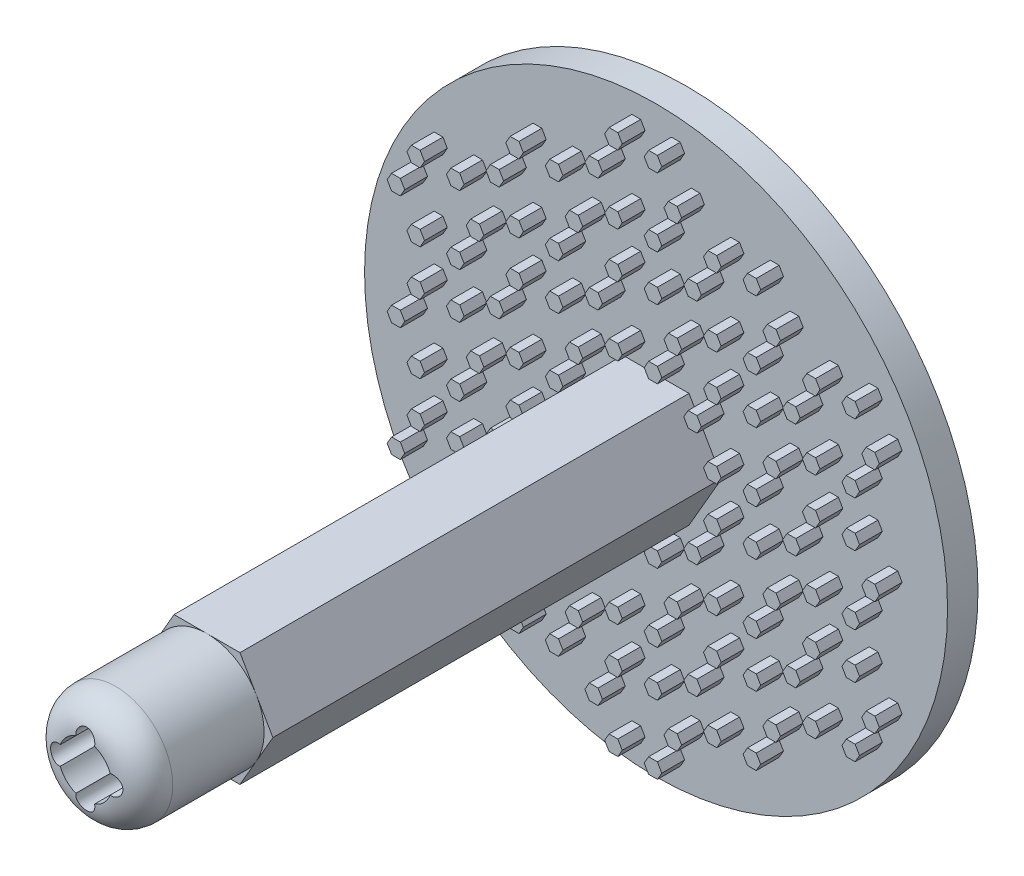
from build123d import *

# Parameters (mm, degrees)
SKETCH1_R                 = 48.641
BOSS_EXTRUDE1_DEPTH       = 5.08
SKETCH2_R                 = 9.525
BOSS_EXTRUDE2_DEPTH       = 95.25
SKETCH3_R                 = 6.604
CUT_EXTRUDE1_DEPTH        = 74.93
BOSS_EXTRUDE3_DEPTH       = 74.93
ORIGINAL_FEMALE_NUB_DEPTH = 3.81
CIRPATTERN1_COUNT         = 6
CIRPATTERN2_COPY_1_DEPTH  = 3.81
CIRPATTERN2_COPY_2_DEPTH  = 3.81
CIRPATTERN2_COPY_3_DEPTH  = 3.81
CIRPATTERN2_COPY_4_DEPTH  = 3.81
CIRPATTERN2_COPY_5_DEPTH  = 3.81
CIRPATTERN2_COPY_6_DEPTH  = 3.81
CIRPATTERN2_COPY_7_DEPTH  = 3.81
CIRPATTERN2_COPY_8_DEPTH  = 3.81
CIRPATTERN2_COPY_9_DEPTH  = 3.81
CIRPATTERN2_COPY_10_DEPTH = 3.81
CIRPATTERN3_COPY_1_DEPTH  = 3.81
CIRPATTERN3_COPY_2_DEPTH  = 3.81
CIRPATTERN3_COPY_3_DEPTH  = 3.81
CIRPATTERN3_COPY_4_DEPTH  = 3.81
CIRPATTERN3_COPY_5_DEPTH  = 3.81
CIRPATTERN3_COPY_6_DEPTH  = 3.81
CIRPATTERN3_COPY_7_DEPTH  = 3.81
CIRPATTERN3_COPY_8_DEPTH  = 3.81
CIRPATTERN3_COPY_9_DEPTH  = 3.81
CIRPATTERN3_COPY_10_DEPTH = 3.81
FILLET1_R                 = 5.08
CUT_EXTRUDE2_DEPTH        = 12.7


with BuildPart() as part:
    # Sketch1 → Boss-Extrude1 (new body)
    with BuildSketch(Plane.XY):
        Circle(SKETCH1_R)
    extrude(amount=BOSS_EXTRUDE1_DEPTH)

    # Sketch2 → Boss-Extrude2 (add)
    with BuildSketch(Plane.XY.offset(5.08)):
        Circle(SKETCH2_R)
    extrude(amount=BOSS_EXTRUDE2_DEPTH)

    # Sketch3 → Cut-Extrude1 (cut)
    with BuildSketch(Plane(origin=(0, 0, 0), x_dir=(-1, 0, 0), z_dir=(0, 0, -1))):
        Circle(SKETCH3_R)
    extrude(amount=-CUT_EXTRUDE1_DEPTH, mode=Mode.SUBTRACT)

    # Sketch4 → Boss-Extrude3 (add)
    with BuildSketch(Plane.XY.offset(5.08)):
        with BuildLine():
            Line((8.248891914, -4.762500099), (10.998522628, 0))
            Line((10.998522628, 0), (8.248892012, 4.762499929))
            ThreePointArc((8.248892012, 4.762499929), (9.525, -9.8e-08), (8.248891914, -4.762500099))
        make_face()
        with BuildLine():
            ThreePointArc((0, 9.525), (4.762500036, 8.248891951), (8.248892012, 4.762499929))
            Line((8.248892012, 4.762499929), (5.499261314, 9.525))
            Line((5.499261314, 9.525), (0, 9.525))
        make_face()
        with BuildLine():
            Line((5.499261314, -9.525), (8.248891914, -4.762500099))
            ThreePointArc((8.248891914, -4.762500099), (4.76249998, -8.248891983), (6.8e-08, -9.525))
            Line((6.8e-08, -9.525), (5.499261314, -9.525))
        make_face()
        with BuildLine():
            ThreePointArc((-8.248891793, 4.762500308), (-4.762499846, 8.24889206), (0, 9.525))
            Line((0, 9.525), (-5.499261314, 9.525))
            Line((-5.499261314, 9.525), (-8.248891793, 4.762500308))
        make_face()
        with BuildLine():
            Line((-5.499261314, -9.525), (6.8e-08, -9.525))
            ThreePointArc((6.8e-08, -9.525), (-4.762499966, -8.248891991), (-8.248891966, -4.762500008))
            Line((-8.248891966, -4.762500008), (-5.499261314, -9.525))
        make_face()
        with BuildLine():
            ThreePointArc((-8.248891966, -4.762500008), (-9.525, 1.73e-07), (-8.248891793, 4.762500308))
            Line((-8.248891793, 4.762500308), (-10.998522628, 0))
            Line((-10.998522628, 0), (-8.248891966, -4.762500008))
        make_face()
    extrude(amount=BOSS_EXTRUDE3_DEPTH)

    # Sketch5 → original_female_nub (add)
    with BuildSketch(Plane.XY.offset(5.08)):
        Polygon((4.03279163, -26.035), (4.766026472, -24.765), (4.03279163, -23.495), (2.566321947, -23.495), (1.833087105, -24.765), (2.566321947, -26.035), align=None)
        Polygon((2.566321947, -12.065), (1.833087105, -13.335), (2.566321947, -14.605), (4.03279163, -14.605), (4.766026472, -13.335), (4.03279163, -12.065), align=None)
        Polygon((-1.833087105, -24.765), (-2.566321947, -23.495), (-4.03279163, -23.495), (-4.766026472, -24.765), (-4.03279163, -26.035), (-2.566321947, -26.035), align=None)
        Polygon((-4.03279163, -14.605), (-2.566321947, -14.605), (-1.833087105, -13.335), (-2.566321947, -12.065), (-4.03279163, -12.065), (-4.766026472, -13.335), align=None)
        Polygon((7.332348419, -17.78), (5.865878735, -17.78), (5.132643893, -19.05), (5.865878735, -20.32), (7.332348419, -20.32), (8.065583261, -19.05), align=None)
        Polygon((-5.865878735, -17.78), (-7.332348419, -17.78), (-8.065583261, -19.05), (-7.332348419, -20.32), (-5.865878735, -20.32), (-5.132643893, -19.05), align=None)
    original_female_nub = extrude(amount=ORIGINAL_FEMALE_NUB_DEPTH)

    # CirPattern1: original_female_nub ×6 about axis
    cirpattern1_axis = Axis((0, 0, 100.33), (0, 0, 1))
    for i in range(1, CIRPATTERN1_COUNT):
        add(original_female_nub.rotate(cirpattern1_axis, i * 360 / CIRPATTERN1_COUNT))

    # Mirror1: original_female_nub across plane
    add(original_female_nub.mirror(Plane(origin=(0, -28.575, 0), x_dir=(0, 0, 1), z_dir=(0, -1, 0))))

    # CirPattern2 copy 1 sketch → CirPattern2 copy 1 (add)
    with BuildSketch(Plane(origin=(49.493351826, -28.575, 5.08), x_dir=(0.5000000000000001, 0.8660254037844386, 0), z_dir=(0, 0, 1))):
        Polygon((4.03279163, 26.035), (4.766026472, 24.765), (4.03279163, 23.495), (2.566321947, 23.495), (1.833087105, 24.765), (2.566321947, 26.035), align=None)
        Polygon((2.566321947, 12.065), (1.833087105, 13.335), (2.566321947, 14.605), (4.03279163, 14.605), (4.766026472, 13.335), (4.03279163, 12.065), align=None)
        Polygon((-1.833087105, 24.765), (-2.566321947, 23.495), (-4.03279163, 23.495), (-4.766026472, 24.765), (-4.03279163, 26.035), (-2.566321947, 26.035), align=None)
        Polygon((-4.03279163, 14.605), (-2.566321947, 14.605), (-1.833087105, 13.335), (-2.566321947, 12.065), (-4.03279163, 12.065), (-4.766026472, 13.335), align=None)
        Polygon((7.332348419, 17.78), (5.865878735, 17.78), (5.132643893, 19.05), (5.865878735, 20.32), (7.332348419, 20.32), (8.065583261, 19.05), align=None)
        Polygon((-5.865878735, 17.78), (-7.332348419, 17.78), (-8.065583261, 19.05), (-7.332348419, 20.32), (-5.865878735, 20.32), (-5.132643893, 19.05), align=None)
    extrude(amount=CIRPATTERN2_COPY_1_DEPTH)

    # CirPattern2 copy 2 sketch → CirPattern2 copy 2 (add)
    with BuildSketch(Plane(origin=(49.493351826, 28.575, 5.08), x_dir=(-0.4999999999999998, 0.8660254037844387, 0), z_dir=(0, 0, 1))):
        Polygon((4.03279163, 26.035), (4.766026472, 24.765), (4.03279163, 23.495), (2.566321947, 23.495), (1.833087105, 24.765), (2.566321947, 26.035), align=None)
        Polygon((2.566321947, 12.065), (1.833087105, 13.335), (2.566321947, 14.605), (4.03279163, 14.605), (4.766026472, 13.335), (4.03279163, 12.065), align=None)
        Polygon((-1.833087105, 24.765), (-2.566321947, 23.495), (-4.03279163, 23.495), (-4.766026472, 24.765), (-4.03279163, 26.035), (-2.566321947, 26.035), align=None)
        Polygon((-4.03279163, 14.605), (-2.566321947, 14.605), (-1.833087105, 13.335), (-2.566321947, 12.065), (-4.03279163, 12.065), (-4.766026472, 13.335), align=None)
        Polygon((7.332348419, 17.78), (5.865878735, 17.78), (5.132643893, 19.05), (5.865878735, 20.32), (7.332348419, 20.32), (8.065583261, 19.05), align=None)
        Polygon((-5.865878735, 17.78), (-7.332348419, 17.78), (-8.065583261, 19.05), (-7.332348419, 20.32), (-5.865878735, 20.32), (-5.132643893, 19.05), align=None)
    extrude(amount=CIRPATTERN2_COPY_2_DEPTH)

    # CirPattern2 copy 3 sketch → CirPattern2 copy 3 (add)
    with BuildSketch(Plane(origin=(0, 57.15, 5.08), x_dir=(-1, 0, 0), z_dir=(0, 0, 1))):
        Polygon((4.03279163, 26.035), (4.766026472, 24.765), (4.03279163, 23.495), (2.566321947, 23.495), (1.833087105, 24.765), (2.566321947, 26.035), align=None)
        Polygon((2.566321947, 12.065), (1.833087105, 13.335), (2.566321947, 14.605), (4.03279163, 14.605), (4.766026472, 13.335), (4.03279163, 12.065), align=None)
        Polygon((-1.833087105, 24.765), (-2.566321947, 23.495), (-4.03279163, 23.495), (-4.766026472, 24.765), (-4.03279163, 26.035), (-2.566321947, 26.035), align=None)
        Polygon((-4.03279163, 14.605), (-2.566321947, 14.605), (-1.833087105, 13.335), (-2.566321947, 12.065), (-4.03279163, 12.065), (-4.766026472, 13.335), align=None)
        Polygon((7.332348419, 17.78), (5.865878735, 17.78), (5.132643893, 19.05), (5.865878735, 20.32), (7.332348419, 20.32), (8.065583261, 19.05), align=None)
        Polygon((-5.865878735, 17.78), (-7.332348419, 17.78), (-8.065583261, 19.05), (-7.332348419, 20.32), (-5.865878735, 20.32), (-5.132643893, 19.05), align=None)
    extrude(amount=CIRPATTERN2_COPY_3_DEPTH)

    # CirPattern2 copy 4 sketch → CirPattern2 copy 4 (add)
    with BuildSketch(Plane(origin=(-49.493351826, 28.575, 5.08), x_dir=(-0.5000000000000004, -0.8660254037844384, 0), z_dir=(0, 0, 1))):
        Polygon((4.03279163, 26.035), (4.766026472, 24.765), (4.03279163, 23.495), (2.566321947, 23.495), (1.833087105, 24.765), (2.566321947, 26.035), align=None)
        Polygon((2.566321947, 12.065), (1.833087105, 13.335), (2.566321947, 14.605), (4.03279163, 14.605), (4.766026472, 13.335), (4.03279163, 12.065), align=None)
        Polygon((-1.833087105, 24.765), (-2.566321947, 23.495), (-4.03279163, 23.495), (-4.766026472, 24.765), (-4.03279163, 26.035), (-2.566321947, 26.035), align=None)
        Polygon((-4.03279163, 14.605), (-2.566321947, 14.605), (-1.833087105, 13.335), (-2.566321947, 12.065), (-4.03279163, 12.065), (-4.766026472, 13.335), align=None)
        Polygon((7.332348419, 17.78), (5.865878735, 17.78), (5.132643893, 19.05), (5.865878735, 20.32), (7.332348419, 20.32), (8.065583261, 19.05), align=None)
        Polygon((-5.865878735, 17.78), (-7.332348419, 17.78), (-8.065583261, 19.05), (-7.332348419, 20.32), (-5.865878735, 20.32), (-5.132643893, 19.05), align=None)
    extrude(amount=CIRPATTERN2_COPY_4_DEPTH)

    # CirPattern2 copy 5 sketch → CirPattern2 copy 5 (add)
    with BuildSketch(Plane(origin=(-49.493351826, -28.575, 5.08), x_dir=(0.5000000000000001, -0.8660254037844386, 0), z_dir=(0, 0, 1))):
        Polygon((4.03279163, 26.035), (4.766026472, 24.765), (4.03279163, 23.495), (2.566321947, 23.495), (1.833087105, 24.765), (2.566321947, 26.035), align=None)
        Polygon((2.566321947, 12.065), (1.833087105, 13.335), (2.566321947, 14.605), (4.03279163, 14.605), (4.766026472, 13.335), (4.03279163, 12.065), align=None)
        Polygon((-1.833087105, 24.765), (-2.566321947, 23.495), (-4.03279163, 23.495), (-4.766026472, 24.765), (-4.03279163, 26.035), (-2.566321947, 26.035), align=None)
        Polygon((-4.03279163, 14.605), (-2.566321947, 14.605), (-1.833087105, 13.335), (-2.566321947, 12.065), (-4.03279163, 12.065), (-4.766026472, 13.335), align=None)
        Polygon((7.332348419, 17.78), (5.865878735, 17.78), (5.132643893, 19.05), (5.865878735, 20.32), (7.332348419, 20.32), (8.065583261, 19.05), align=None)
        Polygon((-5.865878735, 17.78), (-7.332348419, 17.78), (-8.065583261, 19.05), (-7.332348419, 20.32), (-5.865878735, 20.32), (-5.132643893, 19.05), align=None)
    extrude(amount=CIRPATTERN2_COPY_5_DEPTH)

    # CirPattern2 copy 6 sketch → CirPattern2 copy 6 (add)
    with BuildSketch(Plane(origin=(0, 0, 5.08), x_dir=(0.5000000000000001, 0.8660254037844386, 0), z_dir=(0, 0, 1))):
        Polygon((4.03279163, -26.035), (4.766026472, -24.765), (4.03279163, -23.495), (2.566321947, -23.495), (1.833087105, -24.765), (2.566321947, -26.035), align=None)
        Polygon((2.566321947, -12.065), (1.833087105, -13.335), (2.566321947, -14.605), (4.03279163, -14.605), (4.766026472, -13.335), (4.03279163, -12.065), align=None)
        Polygon((-1.833087105, -24.765), (-2.566321947, -23.495), (-4.03279163, -23.495), (-4.766026472, -24.765), (-4.03279163, -26.035), (-2.566321947, -26.035), align=None)
        Polygon((-4.03279163, -14.605), (-2.566321947, -14.605), (-1.833087105, -13.335), (-2.566321947, -12.065), (-4.03279163, -12.065), (-4.766026472, -13.335), align=None)
        Polygon((7.332348419, -17.78), (5.865878735, -17.78), (5.132643893, -19.05), (5.865878735, -20.32), (7.332348419, -20.32), (8.065583261, -19.05), align=None)
        Polygon((-5.865878735, -17.78), (-7.332348419, -17.78), (-8.065583261, -19.05), (-7.332348419, -20.32), (-5.865878735, -20.32), (-5.132643893, -19.05), align=None)
    extrude(amount=CIRPATTERN2_COPY_6_DEPTH)

    # CirPattern2 copy 7 sketch → CirPattern2 copy 7 (add)
    with BuildSketch(Plane(origin=(0, 0, 5.08), x_dir=(-0.4999999999999998, 0.8660254037844387, 0), z_dir=(0, 0, 1))):
        Polygon((4.03279163, -26.035), (4.766026472, -24.765), (4.03279163, -23.495), (2.566321947, -23.495), (1.833087105, -24.765), (2.566321947, -26.035), align=None)
        Polygon((2.566321947, -12.065), (1.833087105, -13.335), (2.566321947, -14.605), (4.03279163, -14.605), (4.766026472, -13.335), (4.03279163, -12.065), align=None)
        Polygon((-1.833087105, -24.765), (-2.566321947, -23.495), (-4.03279163, -23.495), (-4.766026472, -24.765), (-4.03279163, -26.035), (-2.566321947, -26.035), align=None)
        Polygon((-4.03279163, -14.605), (-2.566321947, -14.605), (-1.833087105, -13.335), (-2.566321947, -12.065), (-4.03279163, -12.065), (-4.766026472, -13.335), align=None)
        Polygon((7.332348419, -17.78), (5.865878735, -17.78), (5.132643893, -19.05), (5.865878735, -20.32), (7.332348419, -20.32), (8.065583261, -19.05), align=None)
        Polygon((-5.865878735, -17.78), (-7.332348419, -17.78), (-8.065583261, -19.05), (-7.332348419, -20.32), (-5.865878735, -20.32), (-5.132643893, -19.05), align=None)
    extrude(amount=CIRPATTERN2_COPY_7_DEPTH)

    # CirPattern2 copy 8 sketch → CirPattern2 copy 8 (add)
    with BuildSketch(Plane(origin=(0, 0, 5.08), x_dir=(-1, 0, 0), z_dir=(0, 0, 1))):
        Polygon((4.03279163, -26.035), (4.766026472, -24.765), (4.03279163, -23.495), (2.566321947, -23.495), (1.833087105, -24.765), (2.566321947, -26.035), align=None)
        Polygon((2.566321947, -12.065), (1.833087105, -13.335), (2.566321947, -14.605), (4.03279163, -14.605), (4.766026472, -13.335), (4.03279163, -12.065), align=None)
        Polygon((-1.833087105, -24.765), (-2.566321947, -23.495), (-4.03279163, -23.495), (-4.766026472, -24.765), (-4.03279163, -26.035), (-2.566321947, -26.035), align=None)
        Polygon((-4.03279163, -14.605), (-2.566321947, -14.605), (-1.833087105, -13.335), (-2.566321947, -12.065), (-4.03279163, -12.065), (-4.766026472, -13.335), align=None)
        Polygon((7.332348419, -17.78), (5.865878735, -17.78), (5.132643893, -19.05), (5.865878735, -20.32), (7.332348419, -20.32), (8.065583261, -19.05), align=None)
        Polygon((-5.865878735, -17.78), (-7.332348419, -17.78), (-8.065583261, -19.05), (-7.332348419, -20.32), (-5.865878735, -20.32), (-5.132643893, -19.05), align=None)
    extrude(amount=CIRPATTERN2_COPY_8_DEPTH)

    # CirPattern2 copy 9 sketch → CirPattern2 copy 9 (add)
    with BuildSketch(Plane(origin=(0, 0, 5.08), x_dir=(-0.5000000000000004, -0.8660254037844384, 0), z_dir=(0, 0, 1))):
        Polygon((4.03279163, -26.035), (4.766026472, -24.765), (4.03279163, -23.495), (2.566321947, -23.495), (1.833087105, -24.765), (2.566321947, -26.035), align=None)
        Polygon((2.566321947, -12.065), (1.833087105, -13.335), (2.566321947, -14.605), (4.03279163, -14.605), (4.766026472, -13.335), (4.03279163, -12.065), align=None)
        Polygon((-1.833087105, -24.765), (-2.566321947, -23.495), (-4.03279163, -23.495), (-4.766026472, -24.765), (-4.03279163, -26.035), (-2.566321947, -26.035), align=None)
        Polygon((-4.03279163, -14.605), (-2.566321947, -14.605), (-1.833087105, -13.335), (-2.566321947, -12.065), (-4.03279163, -12.065), (-4.766026472, -13.335), align=None)
        Polygon((7.332348419, -17.78), (5.865878735, -17.78), (5.132643893, -19.05), (5.865878735, -20.32), (7.332348419, -20.32), (8.065583261, -19.05), align=None)
        Polygon((-5.865878735, -17.78), (-7.332348419, -17.78), (-8.065583261, -19.05), (-7.332348419, -20.32), (-5.865878735, -20.32), (-5.132643893, -19.05), align=None)
    extrude(amount=CIRPATTERN2_COPY_9_DEPTH)

    # CirPattern2 copy 10 sketch → CirPattern2 copy 10 (add)
    with BuildSketch(Plane(origin=(0, 0, 5.08), x_dir=(0.5000000000000001, -0.8660254037844386, 0), z_dir=(0, 0, 1))):
        Polygon((4.03279163, -26.035), (4.766026472, -24.765), (4.03279163, -23.495), (2.566321947, -23.495), (1.833087105, -24.765), (2.566321947, -26.035), align=None)
        Polygon((2.566321947, -12.065), (1.833087105, -13.335), (2.566321947, -14.605), (4.03279163, -14.605), (4.766026472, -13.335), (4.03279163, -12.065), align=None)
        Polygon((-1.833087105, -24.765), (-2.566321947, -23.495), (-4.03279163, -23.495), (-4.766026472, -24.765), (-4.03279163, -26.035), (-2.566321947, -26.035), align=None)
        Polygon((-4.03279163, -14.605), (-2.566321947, -14.605), (-1.833087105, -13.335), (-2.566321947, -12.065), (-4.03279163, -12.065), (-4.766026472, -13.335), align=None)
        Polygon((7.332348419, -17.78), (5.865878735, -17.78), (5.132643893, -19.05), (5.865878735, -20.32), (7.332348419, -20.32), (8.065583261, -19.05), align=None)
        Polygon((-5.865878735, -17.78), (-7.332348419, -17.78), (-8.065583261, -19.05), (-7.332348419, -20.32), (-5.865878735, -20.32), (-5.132643893, -19.05), align=None)
    extrude(amount=CIRPATTERN2_COPY_10_DEPTH)

    # Mirror2: original_female_nub across plane
    add(original_female_nub.mirror(Plane(origin=(-16.497783942, -9.525, 0), x_dir=(0, 0, 1), z_dir=(0.8660254037844386, 0.5000000000000001, 0))))

    # CirPattern3 copy 1 sketch → CirPattern3 copy 1 (add)
    with BuildSketch(Plane(origin=(0, -38.1, 5.08), x_dir=(0.5000000000000002, -0.8660254037844386, 0), z_dir=(0, 0, 1))):
        Polygon((4.03279163, 26.035), (4.766026472, 24.765), (4.03279163, 23.495), (2.566321947, 23.495), (1.833087105, 24.765), (2.566321947, 26.035), align=None)
        Polygon((2.566321947, 12.065), (1.833087105, 13.335), (2.566321947, 14.605), (4.03279163, 14.605), (4.766026472, 13.335), (4.03279163, 12.065), align=None)
        Polygon((-1.833087105, 24.765), (-2.566321947, 23.495), (-4.03279163, 23.495), (-4.766026472, 24.765), (-4.03279163, 26.035), (-2.566321947, 26.035), align=None)
        Polygon((-4.03279163, 14.605), (-2.566321947, 14.605), (-1.833087105, 13.335), (-2.566321947, 12.065), (-4.03279163, 12.065), (-4.766026472, 13.335), align=None)
        Polygon((7.332348419, 17.78), (5.865878735, 17.78), (5.132643893, 19.05), (5.865878735, 20.32), (7.332348419, 20.32), (8.065583261, 19.05), align=None)
        Polygon((-5.865878735, 17.78), (-7.332348419, 17.78), (-8.065583261, 19.05), (-7.332348419, 20.32), (-5.865878735, 20.32), (-5.132643893, 19.05), align=None)
    extrude(amount=CIRPATTERN3_COPY_1_DEPTH)

    # CirPattern3 copy 2 sketch → CirPattern3 copy 2 (add)
    with BuildSketch(Plane(origin=(32.995567884, -19.05, 5.08), x_dir=(1, 0, 0), z_dir=(0, 0, 1))):
        Polygon((4.03279163, 26.035), (4.766026472, 24.765), (4.03279163, 23.495), (2.566321947, 23.495), (1.833087105, 24.765), (2.566321947, 26.035), align=None)
        Polygon((2.566321947, 12.065), (1.833087105, 13.335), (2.566321947, 14.605), (4.03279163, 14.605), (4.766026472, 13.335), (4.03279163, 12.065), align=None)
        Polygon((-1.833087105, 24.765), (-2.566321947, 23.495), (-4.03279163, 23.495), (-4.766026472, 24.765), (-4.03279163, 26.035), (-2.566321947, 26.035), align=None)
        Polygon((-4.03279163, 14.605), (-2.566321947, 14.605), (-1.833087105, 13.335), (-2.566321947, 12.065), (-4.03279163, 12.065), (-4.766026472, 13.335), align=None)
        Polygon((7.332348419, 17.78), (5.865878735, 17.78), (5.132643893, 19.05), (5.865878735, 20.32), (7.332348419, 20.32), (8.065583261, 19.05), align=None)
        Polygon((-5.865878735, 17.78), (-7.332348419, 17.78), (-8.065583261, 19.05), (-7.332348419, 20.32), (-5.865878735, 20.32), (-5.132643893, 19.05), align=None)
    extrude(amount=CIRPATTERN3_COPY_2_DEPTH)

    # CirPattern3 copy 3 sketch → CirPattern3 copy 3 (add)
    with BuildSketch(Plane(origin=(32.995567884, 19.05, 5.08), x_dir=(0.4999999999999999, 0.8660254037844387, 0), z_dir=(0, 0, 1))):
        Polygon((4.03279163, 26.035), (4.766026472, 24.765), (4.03279163, 23.495), (2.566321947, 23.495), (1.833087105, 24.765), (2.566321947, 26.035), align=None)
        Polygon((2.566321947, 12.065), (1.833087105, 13.335), (2.566321947, 14.605), (4.03279163, 14.605), (4.766026472, 13.335), (4.03279163, 12.065), align=None)
        Polygon((-1.833087105, 24.765), (-2.566321947, 23.495), (-4.03279163, 23.495), (-4.766026472, 24.765), (-4.03279163, 26.035), (-2.566321947, 26.035), align=None)
        Polygon((-4.03279163, 14.605), (-2.566321947, 14.605), (-1.833087105, 13.335), (-2.566321947, 12.065), (-4.03279163, 12.065), (-4.766026472, 13.335), align=None)
        Polygon((7.332348419, 17.78), (5.865878735, 17.78), (5.132643893, 19.05), (5.865878735, 20.32), (7.332348419, 20.32), (8.065583261, 19.05), align=None)
        Polygon((-5.865878735, 17.78), (-7.332348419, 17.78), (-8.065583261, 19.05), (-7.332348419, 20.32), (-5.865878735, 20.32), (-5.132643893, 19.05), align=None)
    extrude(amount=CIRPATTERN3_COPY_3_DEPTH)

    # CirPattern3 copy 4 sketch → CirPattern3 copy 4 (add)
    with BuildSketch(Plane(origin=(0, 38.1, 5.08), x_dir=(-0.4999999999999998, 0.8660254037844388, 0), z_dir=(0, 0, 1))):
        Polygon((4.03279163, 26.035), (4.766026472, 24.765), (4.03279163, 23.495), (2.566321947, 23.495), (1.833087105, 24.765), (2.566321947, 26.035), align=None)
        Polygon((2.566321947, 12.065), (1.833087105, 13.335), (2.566321947, 14.605), (4.03279163, 14.605), (4.766026472, 13.335), (4.03279163, 12.065), align=None)
        Polygon((-1.833087105, 24.765), (-2.566321947, 23.495), (-4.03279163, 23.495), (-4.766026472, 24.765), (-4.03279163, 26.035), (-2.566321947, 26.035), align=None)
        Polygon((-4.03279163, 14.605), (-2.566321947, 14.605), (-1.833087105, 13.335), (-2.566321947, 12.065), (-4.03279163, 12.065), (-4.766026472, 13.335), align=None)
        Polygon((7.332348419, 17.78), (5.865878735, 17.78), (5.132643893, 19.05), (5.865878735, 20.32), (7.332348419, 20.32), (8.065583261, 19.05), align=None)
        Polygon((-5.865878735, 17.78), (-7.332348419, 17.78), (-8.065583261, 19.05), (-7.332348419, 20.32), (-5.865878735, 20.32), (-5.132643893, 19.05), align=None)
    extrude(amount=CIRPATTERN3_COPY_4_DEPTH)

    # CirPattern3 copy 5 sketch → CirPattern3 copy 5 (add)
    with BuildSketch(Plane(origin=(-32.995567884, 19.05, 5.08), x_dir=(-1, 0, 0), z_dir=(0, 0, 1))):
        Polygon((4.03279163, 26.035), (4.766026472, 24.765), (4.03279163, 23.495), (2.566321947, 23.495), (1.833087105, 24.765), (2.566321947, 26.035), align=None)
        Polygon((2.566321947, 12.065), (1.833087105, 13.335), (2.566321947, 14.605), (4.03279163, 14.605), (4.766026472, 13.335), (4.03279163, 12.065), align=None)
        Polygon((-1.833087105, 24.765), (-2.566321947, 23.495), (-4.03279163, 23.495), (-4.766026472, 24.765), (-4.03279163, 26.035), (-2.566321947, 26.035), align=None)
        Polygon((-4.03279163, 14.605), (-2.566321947, 14.605), (-1.833087105, 13.335), (-2.566321947, 12.065), (-4.03279163, 12.065), (-4.766026472, 13.335), align=None)
        Polygon((7.332348419, 17.78), (5.865878735, 17.78), (5.132643893, 19.05), (5.865878735, 20.32), (7.332348419, 20.32), (8.065583261, 19.05), align=None)
        Polygon((-5.865878735, 17.78), (-7.332348419, 17.78), (-8.065583261, 19.05), (-7.332348419, 20.32), (-5.865878735, 20.32), (-5.132643893, 19.05), align=None)
    extrude(amount=CIRPATTERN3_COPY_5_DEPTH)

    # CirPattern3 copy 6 sketch → CirPattern3 copy 6 (add)
    with BuildSketch(Plane(origin=(0, 0, 5.08), x_dir=(0.5000000000000001, 0.8660254037844386, 0), z_dir=(0, 0, 1))):
        Polygon((4.03279163, -26.035), (4.766026472, -24.765), (4.03279163, -23.495), (2.566321947, -23.495), (1.833087105, -24.765), (2.566321947, -26.035), align=None)
        Polygon((2.566321947, -12.065), (1.833087105, -13.335), (2.566321947, -14.605), (4.03279163, -14.605), (4.766026472, -13.335), (4.03279163, -12.065), align=None)
        Polygon((-1.833087105, -24.765), (-2.566321947, -23.495), (-4.03279163, -23.495), (-4.766026472, -24.765), (-4.03279163, -26.035), (-2.566321947, -26.035), align=None)
        Polygon((-4.03279163, -14.605), (-2.566321947, -14.605), (-1.833087105, -13.335), (-2.566321947, -12.065), (-4.03279163, -12.065), (-4.766026472, -13.335), align=None)
        Polygon((7.332348419, -17.78), (5.865878735, -17.78), (5.132643893, -19.05), (5.865878735, -20.32), (7.332348419, -20.32), (8.065583261, -19.05), align=None)
        Polygon((-5.865878735, -17.78), (-7.332348419, -17.78), (-8.065583261, -19.05), (-7.332348419, -20.32), (-5.865878735, -20.32), (-5.132643893, -19.05), align=None)
    extrude(amount=CIRPATTERN3_COPY_6_DEPTH)

    # CirPattern3 copy 7 sketch → CirPattern3 copy 7 (add)
    with BuildSketch(Plane(origin=(0, 0, 5.08), x_dir=(-0.4999999999999998, 0.8660254037844387, 0), z_dir=(0, 0, 1))):
        Polygon((4.03279163, -26.035), (4.766026472, -24.765), (4.03279163, -23.495), (2.566321947, -23.495), (1.833087105, -24.765), (2.566321947, -26.035), align=None)
        Polygon((2.566321947, -12.065), (1.833087105, -13.335), (2.566321947, -14.605), (4.03279163, -14.605), (4.766026472, -13.335), (4.03279163, -12.065), align=None)
        Polygon((-1.833087105, -24.765), (-2.566321947, -23.495), (-4.03279163, -23.495), (-4.766026472, -24.765), (-4.03279163, -26.035), (-2.566321947, -26.035), align=None)
        Polygon((-4.03279163, -14.605), (-2.566321947, -14.605), (-1.833087105, -13.335), (-2.566321947, -12.065), (-4.03279163, -12.065), (-4.766026472, -13.335), align=None)
        Polygon((7.332348419, -17.78), (5.865878735, -17.78), (5.132643893, -19.05), (5.865878735, -20.32), (7.332348419, -20.32), (8.065583261, -19.05), align=None)
        Polygon((-5.865878735, -17.78), (-7.332348419, -17.78), (-8.065583261, -19.05), (-7.332348419, -20.32), (-5.865878735, -20.32), (-5.132643893, -19.05), align=None)
    extrude(amount=CIRPATTERN3_COPY_7_DEPTH)

    # CirPattern3 copy 8 sketch → CirPattern3 copy 8 (add)
    with BuildSketch(Plane(origin=(0, 0, 5.08), x_dir=(-1, 0, 0), z_dir=(0, 0, 1))):
        Polygon((4.03279163, -26.035), (4.766026472, -24.765), (4.03279163, -23.495), (2.566321947, -23.495), (1.833087105, -24.765), (2.566321947, -26.035), align=None)
        Polygon((2.566321947, -12.065), (1.833087105, -13.335), (2.566321947, -14.605), (4.03279163, -14.605), (4.766026472, -13.335), (4.03279163, -12.065), align=None)
        Polygon((-1.833087105, -24.765), (-2.566321947, -23.495), (-4.03279163, -23.495), (-4.766026472, -24.765), (-4.03279163, -26.035), (-2.566321947, -26.035), align=None)
        Polygon((-4.03279163, -14.605), (-2.566321947, -14.605), (-1.833087105, -13.335), (-2.566321947, -12.065), (-4.03279163, -12.065), (-4.766026472, -13.335), align=None)
        Polygon((7.332348419, -17.78), (5.865878735, -17.78), (5.132643893, -19.05), (5.865878735, -20.32), (7.332348419, -20.32), (8.065583261, -19.05), align=None)
        Polygon((-5.865878735, -17.78), (-7.332348419, -17.78), (-8.065583261, -19.05), (-7.332348419, -20.32), (-5.865878735, -20.32), (-5.132643893, -19.05), align=None)
    extrude(amount=CIRPATTERN3_COPY_8_DEPTH)

    # CirPattern3 copy 9 sketch → CirPattern3 copy 9 (add)
    with BuildSketch(Plane(origin=(0, 0, 5.08), x_dir=(-0.5000000000000004, -0.8660254037844384, 0), z_dir=(0, 0, 1))):
        Polygon((4.03279163, -26.035), (4.766026472, -24.765), (4.03279163, -23.495), (2.566321947, -23.495), (1.833087105, -24.765), (2.566321947, -26.035), align=None)
        Polygon((2.566321947, -12.065), (1.833087105, -13.335), (2.566321947, -14.605), (4.03279163, -14.605), (4.766026472, -13.335), (4.03279163, -12.065), align=None)
        Polygon((-1.833087105, -24.765), (-2.566321947, -23.495), (-4.03279163, -23.495), (-4.766026472, -24.765), (-4.03279163, -26.035), (-2.566321947, -26.035), align=None)
        Polygon((-4.03279163, -14.605), (-2.566321947, -14.605), (-1.833087105, -13.335), (-2.566321947, -12.065), (-4.03279163, -12.065), (-4.766026472, -13.335), align=None)
        Polygon((7.332348419, -17.78), (5.865878735, -17.78), (5.132643893, -19.05), (5.865878735, -20.32), (7.332348419, -20.32), (8.065583261, -19.05), align=None)
        Polygon((-5.865878735, -17.78), (-7.332348419, -17.78), (-8.065583261, -19.05), (-7.332348419, -20.32), (-5.865878735, -20.32), (-5.132643893, -19.05), align=None)
    extrude(amount=CIRPATTERN3_COPY_9_DEPTH)

    # CirPattern3 copy 10 sketch → CirPattern3 copy 10 (add)
    with BuildSketch(Plane(origin=(0, 0, 5.08), x_dir=(0.5000000000000001, -0.8660254037844386, 0), z_dir=(0, 0, 1))):
        Polygon((4.03279163, -26.035), (4.766026472, -24.765), (4.03279163, -23.495), (2.566321947, -23.495), (1.833087105, -24.765), (2.566321947, -26.035), align=None)
        Polygon((2.566321947, -12.065), (1.833087105, -13.335), (2.566321947, -14.605), (4.03279163, -14.605), (4.766026472, -13.335), (4.03279163, -12.065), align=None)
        Polygon((-1.833087105, -24.765), (-2.566321947, -23.495), (-4.03279163, -23.495), (-4.766026472, -24.765), (-4.03279163, -26.035), (-2.566321947, -26.035), align=None)
        Polygon((-4.03279163, -14.605), (-2.566321947, -14.605), (-1.833087105, -13.335), (-2.566321947, -12.065), (-4.03279163, -12.065), (-4.766026472, -13.335), align=None)
        Polygon((7.332348419, -17.78), (5.865878735, -17.78), (5.132643893, -19.05), (5.865878735, -20.32), (7.332348419, -20.32), (8.065583261, -19.05), align=None)
        Polygon((-5.865878735, -17.78), (-7.332348419, -17.78), (-8.065583261, -19.05), (-7.332348419, -20.32), (-5.865878735, -20.32), (-5.132643893, -19.05), align=None)
    extrude(amount=CIRPATTERN3_COPY_10_DEPTH)

    # Fillet1
    fillet1_edges = [part.edges().sort_by_distance(p)[0] for p in [
        (-9.525, 0, 100.33),
    ]]
    fillet(fillet1_edges, radius=FILLET1_R)

    # Sketch11 → Cut-Extrude2 (cut)
    with BuildSketch(Plane.XY.offset(100.33)):
        with BuildLine():
            ThreePointArc((4.161517857, -1.561984035), (6.0325, 0), (4.161517857, 1.561984035))
            ThreePointArc((4.161517857, 1.561984035), (3.143089642, 3.143089642), (1.561984035, 4.161517857))
            ThreePointArc((1.561984035, 4.161517857), (0, 6.0325), (-1.561984035, 4.161517857))
            ThreePointArc((-1.561984035, 4.161517857), (-3.143089642, 3.143089642), (-4.161517857, 1.561984035))
            ThreePointArc((-4.161517857, 1.561984035), (-6.0325, 0), (-4.161517857, -1.561984035))
            ThreePointArc((-4.161517857, -1.561984035), (-3.143089642, -3.143089642), (-1.561984035, -4.161517857))
            ThreePointArc((-1.561984035, -4.161517857), (0, -6.0325), (1.561984035, -4.161517857))
            ThreePointArc((1.561984035, -4.161517857), (3.143089642, -3.143089642), (4.161517857, -1.561984035))
        make_face()
    extrude(amount=-CUT_EXTRUDE2_DEPTH, mode=Mode.SUBTRACT)


solid = part.part
